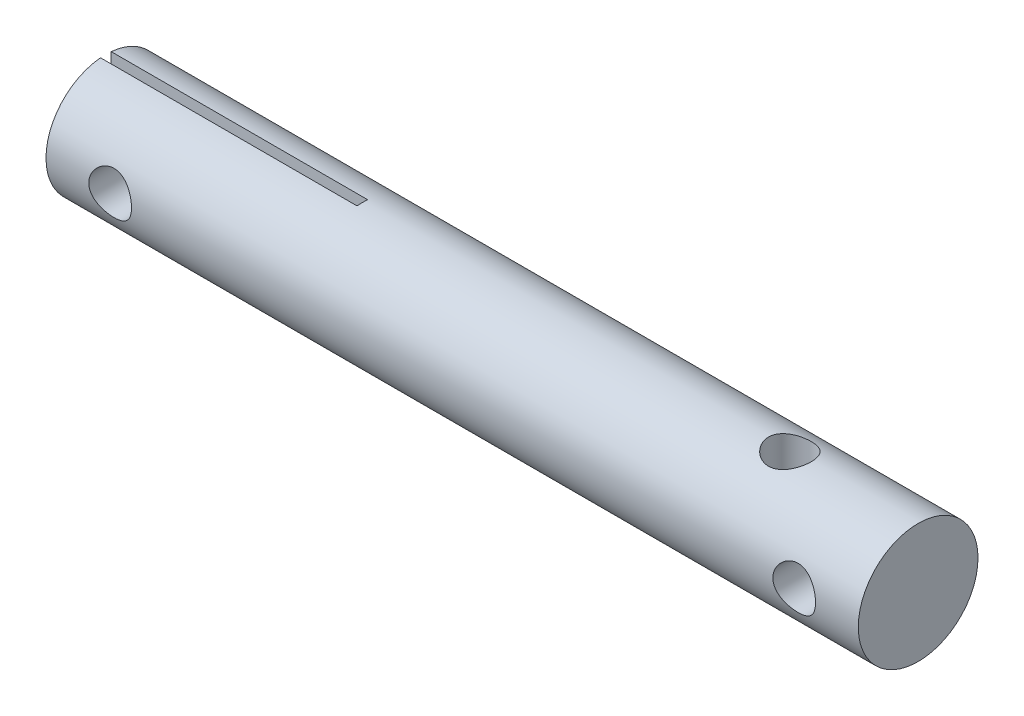
from build123d import *

# Parameters (mm, degrees)
SKETCH_1_R               = 2.8
EXTRUDE_1_DEPTH          = 38
SKETCH_2_W               = 0.5
SKETCH_2_H               = 5.450532248
CUT_EXTRUDE_1_DEPTH      = 12
CUT_EXTRUDE_2_DEPTH      = 10
CUT_EXTRUDE_2_DEPTH_BACK = 10
SKETCH_3_R               = 1
CUT_EXTRUDE_3_DEPTH      = 10
CUT_EXTRUDE_3_DEPTH_BACK = 10
SKETCH_7_R               = 1


with BuildPart() as part:
    # 草图1 → 凸台-拉伸1 (new body)
    with BuildSketch(Plane(origin=(0, 0, 0), x_dir=(0, 0, -1), z_dir=(1, 0, 0))):
        Circle(SKETCH_1_R)
    extrude(amount=EXTRUDE_1_DEPTH)

    # 草图2 → 切除-拉伸1 (cut)
    with BuildSketch(Plane.ZY):
        with Locations((0, 0.396255312)):
            Rectangle(SKETCH_2_W, SKETCH_2_H)
    extrude(amount=-CUT_EXTRUDE_1_DEPTH, mode=Mode.SUBTRACT)

    # 草图3 → 切除-拉伸2 (cut, two sides: drawn at the far end of the back side and taken through both)
    with BuildSketch(Plane(origin=(0, 0, 0.25), x_dir=(-1, 0, 0), z_dir=(0, 0, -1)).offset(-CUT_EXTRUDE_2_DEPTH_BACK)):
        with Locations((-3, -0.005591523)):
            Circle(SKETCH_3_R)
        with Locations((-35, -0.005591523)):
            Circle(SKETCH_3_R)
    extrude(amount=CUT_EXTRUDE_2_DEPTH + CUT_EXTRUDE_2_DEPTH_BACK, mode=Mode.SUBTRACT)

    # 草图7 → 切除-拉伸3 (cut, two sides: drawn at the far end of the back side and taken through both)
    with BuildSketch(Plane(origin=(0, 0, 0), x_dir=(1, 0, 0), z_dir=(0, 1, 0)).offset(-CUT_EXTRUDE_3_DEPTH_BACK)):
        with Locations((32, 0)):
            Circle(SKETCH_7_R)
    extrude(amount=CUT_EXTRUDE_3_DEPTH + CUT_EXTRUDE_3_DEPTH_BACK, mode=Mode.SUBTRACT)


solid = part.part
